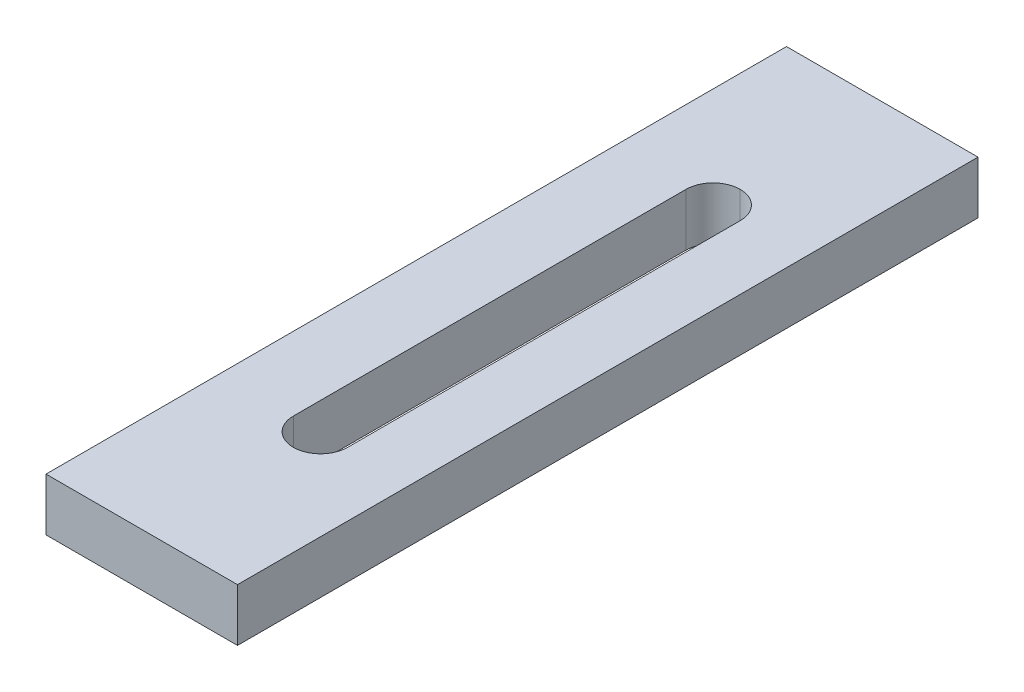
from build123d import *

# Parameters (mm, degrees)
SKIZZE1_W                       = 6
SKIZZE1_H                       = 23.2
SKIZZE1_W_2                     = 1.7
SKIZZE1_H_2                     = 14
AUFSATZ_LINEAR_AUSTRAGEN1_DEPTH = 0.825
VERRUNDUNG2_R                   = 0.85


with BuildPart() as part:
    # Skizze1 → Aufsatz-Linear austragen1 (new, symmetric)
    with BuildSketch(Plane(origin=(0, 0, 0), x_dir=(1, 0, 0), z_dir=(0, 1, 0))):
        Rectangle(SKIZZE1_W, SKIZZE1_H)
        with Locations((0.15, 0)):
            Rectangle(SKIZZE1_W_2, SKIZZE1_H_2, mode=Mode.SUBTRACT)
    extrude(amount=AUFSATZ_LINEAR_AUSTRAGEN1_DEPTH, both=True)

    # Verrundung2
    verrundung2_edges = [part.edges().sort_by_distance(p)[0] for p in [
        (-0.7, 0, 7),
        (1, 0, 7),
        (1, 0, -7),
        (-0.7, 0, -7),
    ]]
    fillet(verrundung2_edges, radius=VERRUNDUNG2_R - 0.0001)  # a hair under: the kernel refuses the full size


solid = part.part
